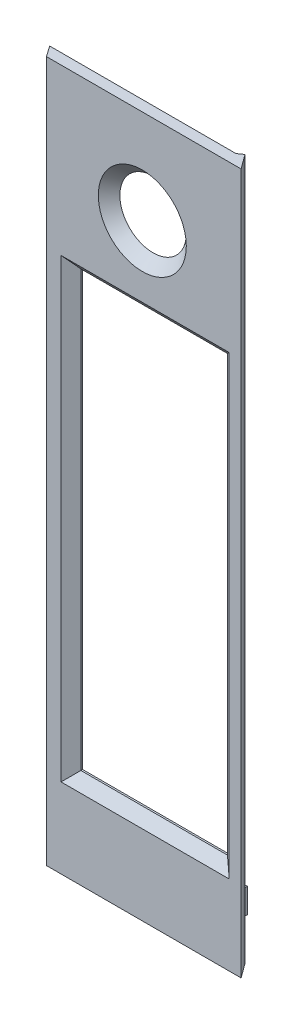
from build123d import *

# Parameters (mm, degrees)
SKETCH_1_W          = 17.278028126
SKETCH_1_H          = 65
SKETCH_1_R          = 3.082023979
SKETCH_1_W_2        = 13.6
SKETCH_1_H_2        = 40.3
EXTRUDE_1_DEPTH     = 1
SKETCH_2_W          = 11.366651046
SKETCH_2_H          = 2.279902362
EXTRUDE_2_DEPTH     = 1.8
EXTRUDE_3_DEPTH     = 65
CUT_EXTRUDE_1_DEPTH = 65
EXTRUDE_4_DEPTH     = 65
CHAMFER_1_SIZE      = 1
CHAMFER_2_SIZE      = 1
CHAMFER_2_SIZE2     = 0.839099631


with BuildPart() as part:
    # 草图1 → 凸台-拉伸1 (new body)
    with BuildSketch(Plane.XY):
        with Locations((-31.11996815, 0)):
            Rectangle(SKETCH_1_W, SKETCH_1_H)
        with Locations((-30.167658157, 23.76)):
            Circle(SKETCH_1_R, mode=Mode.SUBTRACT)
        with Locations((-29.904282539, -3.95)):
            Rectangle(SKETCH_1_W_2, SKETCH_1_H_2, mode=Mode.SUBTRACT)
    extrude(amount=EXTRUDE_1_DEPTH)

    # 草图2 → 凸台-拉伸2 (add)
    with BuildSketch(Plane(origin=(0, 0, 0), x_dir=(-1, 0, 0), z_dir=(0, 0, -1))):
        Polygon((36.267658157, 24.697593501), (36.267658157, 27.721628521), (34.929286678, 29.06), (31.365999463, 29.06), (31.365999463, 28.318477538), (35.267658157, 24.697593501), align=None)
        Polygon((28.825820559, 29.06), (26.391624704, 29.06), (24.367658157, 27.036033454), (24.367658157, 24.969921966), (25.477264987, 24.969921966), (28.825820559, 28.318477538), align=None)
        with Locations((28.887927563, -28.775129659)):
            Rectangle(SKETCH_2_W, SKETCH_2_H)
    extrude(amount=EXTRUDE_2_DEPTH)

    # 草图3 → 凸台-拉伸3 (add)
    with BuildSketch(Plane.XZ.offset(32.5)):
        Polygon((-22.480954087, 1), (-20.997208948, 1), (-21.739081518, 0), (-22.480954087, 0), align=None)
    extrude(amount=-EXTRUDE_3_DEPTH)

    # 草图4 → 切除-拉伸1 (cut)
    with BuildSketch(Plane.XZ.offset(32.5)):
        Polygon((-39.758982213, 0), (-39.058774675, 1), (-39.758982213, 1), align=None)
    extrude(amount=-CUT_EXTRUDE_1_DEPTH, mode=Mode.SUBTRACT)

    # 草图5 → 凸台-拉伸4 (add)
    with BuildSketch(Plane.XZ.offset(32.5)):
        Polygon((-21.739081518, 0), (-21.983150121, -0.34856609), (-22.480954087, 0), align=None)
    extrude(amount=-EXTRUDE_4_DEPTH)

    # 倒角1
    chamfer_1_edges = [part.edges().sort_by_distance(p)[0] for p in [
        (-33.249682136, 23.76, 1),
    ]]
    chamfer(chamfer_1_edges, length=CHAMFER_1_SIZE - 0.0001)  # a hair under: the kernel refuses the full size

    # 倒角2
    chamfer_2_edges = [part.edges().sort_by_distance(p)[0] for p in [
        (-36.704282539, -3.95, 1),
        (-29.904282539, -24.1, 1),
        (-23.104282539, -3.95, 1),
        (-29.904282539, 16.2, 1),
    ]]
    chamfer_2_side = [part.faces().sort_by_distance(p)[0] for p in [
        (-34.924209452, 23.76, 1),
    ]]
    chamfer(chamfer_2_edges, length=CHAMFER_2_SIZE, length2=CHAMFER_2_SIZE2, reference=chamfer_2_side[0])


solid = part.part
